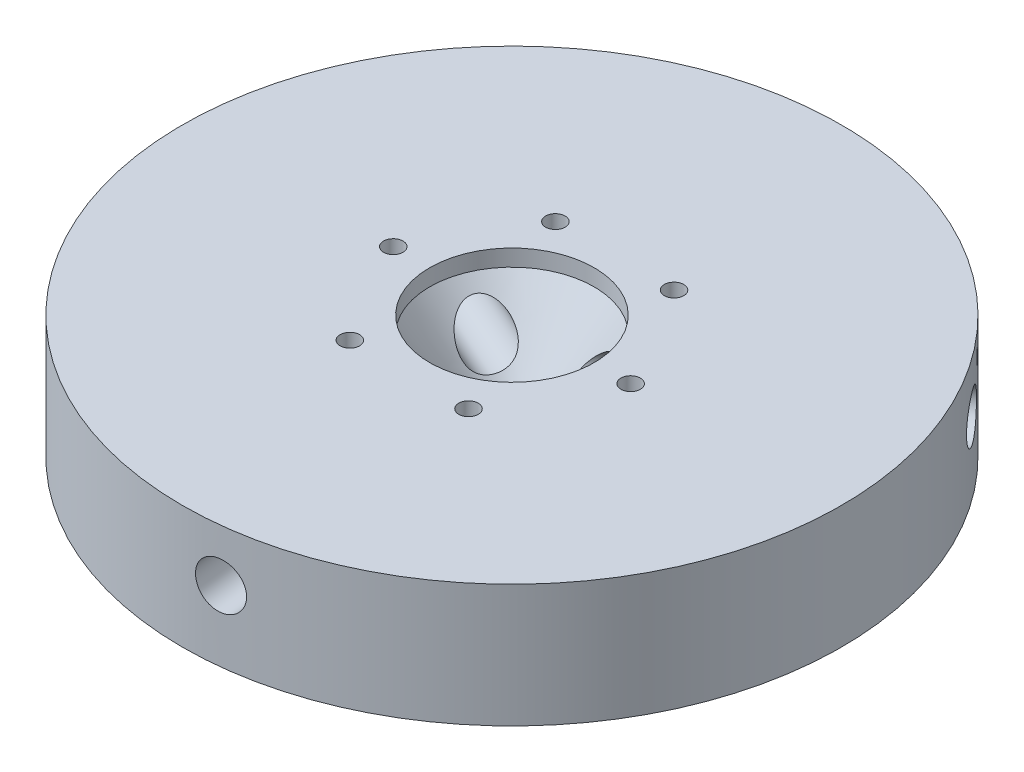
from build123d import *

# Parameters (mm, degrees)
SKETCH1_R           = 80.54
BOSS_EXTRUDE1_DEPTH = 30
SKETCH21_W          = 5
SKETCH21_H          = 3
CIRPATTERN4_COUNT   = 6
SKETCH37_R          = 5.660200505
CUT_EXTRUDE1_DEPTH  = 80
CIRPATTERN6_COUNT   = 3


with BuildPart() as part:
    # Sketch1 → Boss-Extrude1 (new body)
    with BuildSketch(Plane(origin=(0, 0, 0), x_dir=(1, 0, 0), z_dir=(0, 1, 0))):
        Circle(SKETCH1_R)
    extrude(amount=BOSS_EXTRUDE1_DEPTH)

    # Sketch2 → Cut-Revolve1 (revolve, cut)
    with BuildSketch(Plane.XY):
        Polygon((-4.30784, 0), (-4.30784, 5.327023402), (-20.1026, 25.947621226), (-20.1026, 30), (0, 30), (0, 0), align=None)
    revolve(axis=Axis((0, 30, 0), (0, -1, 0)), mode=Mode.SUBTRACT)

    # Sketch21 → Cut-Revolve2 (revolve, cut)
    with BuildSketch(Plane.XY):
        with Locations((62.5, 1.5)):
            Rectangle(SKETCH21_W, SKETCH21_H)
    revolve(axis=Axis((0, 0, 0), (0, -1, 0)), mode=Mode.SUBTRACT)

    # Sketch28 → 3/16 (0.1875) Diameter Hole1 (revolve, cut)
    with BuildSketch(Plane(origin=(29, 30, 0), x_dir=(0, 0, 1), z_dir=(1, 0, 0))):
        Polygon((0, 0), (0, 13.430799349), (2.38125, 12), (2.38125, 0), align=None)
    f_3_16_0_1875_diameter_hole1 = revolve(axis=Axis((29, 36.35, 0), (0, -1, 0)), mode=Mode.SUBTRACT)

    # CirPattern4: 3/16 (0.1875) Diameter Hole1 ×6 about axis
    cirpattern4_axis = Axis((0, 30, 0), (0, -1, 0))
    for i in range(1, CIRPATTERN4_COUNT):
        add(f_3_16_0_1875_diameter_hole1.rotate(cirpattern4_axis, i * 360 / CIRPATTERN4_COUNT), mode=Mode.SUBTRACT)

    # Sketch37 → Cut-Extrude1 (cut)
    with BuildSketch(Plane(origin=(8.800199099, 30, 80.057779733), x_dir=(0.994012661202006, 0, -0.10926495032766072), z_dir=(0.10926495032766072, 0, 0.994012661202006))):
        with Locations((0, -12.801557635)):
            Circle(SKETCH37_R)
    cut_extrude1 = extrude(amount=-CUT_EXTRUDE1_DEPTH, mode=Mode.SUBTRACT)

    # CirPattern6: Cut-Extrude1 ×3 about axis
    cirpattern6_axis = Axis((0, 30, 0), (0, 1, 0))
    for i in range(1, CIRPATTERN6_COUNT):
        add(cut_extrude1.rotate(cirpattern6_axis, i * 360 / CIRPATTERN6_COUNT), mode=Mode.SUBTRACT)


solid = part.part
